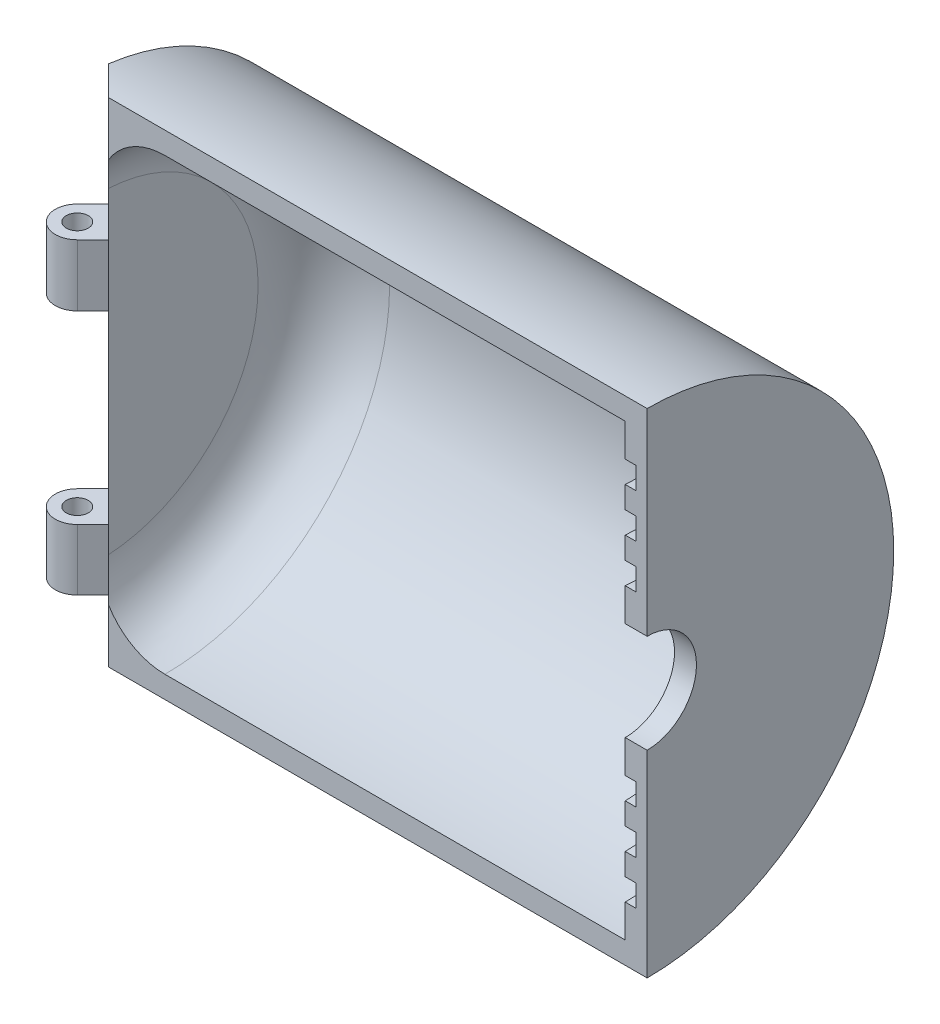
from build123d import *
from build123d.topology import SkipClean

# Parameters (mm, degrees)
BOSS_EXTRUDE1_DEPTH = 1
CUT_EXTRUDE1_DEPTH  = 0.5
BOSS_EXTRUDE2_START = -25
BOSS_EXTRUDE2_DEPTH = 25
BOSS_EXTRUDE3_START = 1
BOSS_EXTRUDE3_DEPTH = 1
SKETCH7_R           = 0.5
BOSS_EXTRUDE4_DEPTH = 22.5
SKETCH10_R          = 0.5
CUT_EXTRUDE4_DEPTH  = 40.5
SKETCH8_W           = 10.868003522
SKETCH8_H           = 5.625
CUT_EXTRUDE2_DEPTH  = 22.5
LPATTERN1_COUNT     = 2
LPATTERN1_PITCH     = 11.25
CUT_EXTRUDE3_START  = -40.5
SKETCH9_R           = 20.473718745
SKETCH9_R_2         = 11.25
CUT_EXTRUDE3_DEPTH  = 40.5
SKETCH11_W          = 6.72531589
SKETCH11_H          = 3.584111804
SKETCH11_W_2        = 7.229090256
SKETCH11_H_2        = 3.619498095
CUT_EXTRUDE5_DEPTH  = 40.5
FILLET1_R           = 3


with BuildPart() as part:
    # Sketch1 → Boss-Extrude1 (new body)
    with BuildSketch(Plane(origin=(0, 0, 0), x_dir=(0, 0, -1), z_dir=(1, 0, 0))):
        with BuildLine():
            Line((0, -2.25), (0, -10.25))
            ThreePointArc((0, -10.25), (10.25, 0), (0, 10.25))
            Line((0, 10.25), (0, 2.25))
            ThreePointArc((0, 2.25), (1.590990258, 1.590990258), (2.25, 0))
            ThreePointArc((2.25, 0), (1.590990258, -1.590990258), (0, -2.25))
        make_face()
    extrude(amount=BOSS_EXTRUDE1_DEPTH)

    # Sketch2 → Cut-Extrude1 (cut)
    with BuildSketch(Plane.ZY):
        with BuildLine():
            ThreePointArc((0, 3.75), (2.651650429, 2.651650429), (3.75, 0))
            ThreePointArc((3.75, 0), (2.651650429, -2.651650429), (0, -3.75))
            Line((0, -3.75), (0, -4.75))
            ThreePointArc((0, -4.75), (3.358757211, -3.358757211), (4.75, 0))
            ThreePointArc((4.75, 0), (3.358757211, 3.358757211), (0, 4.75))
            Line((0, 4.75), (0, 3.75))
        make_face()
        with BuildLine():
            ThreePointArc((0, -3.75), (-3.75, 0), (0, 3.75))
            Line((0, 3.75), (0, 4.75))
            ThreePointArc((0, 4.75), (-4.75, 0), (0, -4.75))
            Line((0, -4.75), (0, -3.75))
        make_face()
        with BuildLine():
            Line((0, 6.75), (0, 5.75))
            ThreePointArc((0, 5.75), (4.065863992, 4.065863992), (5.75, 0))
            ThreePointArc((5.75, 0), (4.065863992, -4.065863992), (0, -5.75))
            Line((0, -5.75), (0, -6.75))
            ThreePointArc((0, -6.75), (4.772970773, -4.772970773), (6.75, 0))
            ThreePointArc((6.75, 0), (4.772970773, 4.772970773), (0, 6.75))
        make_face()
        with BuildLine():
            ThreePointArc((0, -5.75), (-5.75, 0), (0, 5.75))
            Line((0, 5.75), (0, 6.75))
            ThreePointArc((0, 6.75), (-6.75, 0), (0, -6.75))
            Line((0, -6.75), (0, -5.75))
        make_face()
        with BuildLine():
            Line((0, 8.75), (0, 7.75))
            ThreePointArc((0, 7.75), (5.480077554, 5.480077554), (7.75, 0))
            ThreePointArc((7.75, 0), (5.480077554, -5.480077554), (0, -7.75))
            Line((0, -7.75), (0, -8.75))
            ThreePointArc((0, -8.75), (6.187184335, -6.187184335), (8.75, 0))
            ThreePointArc((8.75, 0), (6.187184335, 6.187184335), (0, 8.75))
        make_face()
        with BuildLine():
            ThreePointArc((0, -7.75), (-7.75, 0), (0, 7.75))
            Line((0, 7.75), (0, 8.75))
            ThreePointArc((0, 8.75), (-8.75, 0), (0, -8.75))
            Line((0, -8.75), (0, -7.75))
        make_face()
    extrude(amount=-CUT_EXTRUDE1_DEPTH, mode=Mode.SUBTRACT)

    # Sketch3 → Boss-Extrude2 (add)
    with BuildSketch(Plane(origin=(1, 0, 0), x_dir=(0, 0, -1), z_dir=(1, 0, 0)).offset(BOSS_EXTRUDE2_START)):
        with BuildLine():
            Line((0, -10.25), (0, -11.25))
            ThreePointArc((0, -11.25), (11.25, 0), (0, 11.25))
            Line((0, 11.25), (0, 10.25))
            ThreePointArc((0, 10.25), (10.25, 0), (0, -10.25))
        make_face()
    extrude(amount=BOSS_EXTRUDE2_DEPTH)

    # Sketch6 → Boss-Extrude3 (add)
    with BuildSketch(Plane.ZY.offset(24).offset(BOSS_EXTRUDE3_START)):
        with BuildLine():
            Line((0, 11.25), (0, -11.25))
            ThreePointArc((0, -11.25), (-11.25, 0), (0, 11.25))
        make_face()
    extrude(amount=-BOSS_EXTRUDE3_DEPTH)

    # Sketch7 → Boss-Extrude4 (add)
    with SkipClean():  # the faces are left unmerged after this step: merging them gives an invalid solid
        with BuildSketch(Plane(origin=(0, 11.25, 0), x_dir=(1, 0, 0), z_dir=(0, 1, 0))):
            with BuildLine():
                Line((-23.585786438, 0), (-25, 1.414213562))
                Line((-25, 1.414213562), (-25.707106781, 0.707106781))
                ThreePointArc((-25.707106781, 0.707106781), (-25.707106781, -0.707106781), (-24.292893219, -0.707106781))
                Line((-24.292893219, -0.707106781), (-23.585786438, 0))
            make_face()
            with Locations(Location((-25, 0, 0), (0, 0, 270))):
                Circle(SKETCH7_R, mode=Mode.SUBTRACT)
        extrude(amount=-BOSS_EXTRUDE4_DEPTH)

    # Sketch10 → Cut-Extrude4 (cut)
    with BuildSketch(Plane(origin=(0, 11.25, 0), x_dir=(1, 0, 0), z_dir=(0, 1, 0))):
        with Locations(Location((-25, 0, 0), (0, 0, 270))):
            Circle(SKETCH10_R)
    extrude(amount=-CUT_EXTRUDE4_DEPTH, mode=Mode.SUBTRACT)

    # Sketch8 → Cut-Extrude2 (cut)
    with BuildSketch(Plane(origin=(-11.792893219, 0, -11.792893219), x_dir=(0.7071067811865439, 0, -0.7071067811865511), z_dir=(0.7071067811865511, 0, 0.7071067811865439))):
        with Locations((-22.111671291, 8.4375)):
            Rectangle(SKETCH8_W, SKETCH8_H)
    cut_extrude2 = extrude(amount=-CUT_EXTRUDE2_DEPTH, mode=Mode.SUBTRACT)

    # LPattern1: Cut-Extrude2 ×2
    with Locations(*[(0, -i * LPATTERN1_PITCH, 0) for i in range(1, LPATTERN1_COUNT)]):
        add(cut_extrude2, mode=Mode.SUBTRACT)

    # Sketch9 → Cut-Extrude3 (cut)
    with BuildSketch(Plane(origin=(1, 0, 0), x_dir=(0, 0, -1), z_dir=(1, 0, 0)).offset(CUT_EXTRUDE3_START)):
        Circle(SKETCH9_R)
        Circle(SKETCH9_R_2, mode=Mode.SUBTRACT)
    extrude(amount=CUT_EXTRUDE3_DEPTH, mode=Mode.SUBTRACT)

    # Sketch11 → Cut-Extrude5 (cut)
    with BuildSketch(Plane(origin=(-11.792893219, 0, -11.792893219), x_dir=(0.7071067811865434, 0, -0.7071067811865517), z_dir=(0.7071067811865517, 0, 0.7071067811865434))):
        with Locations((-20.040327475, 1.020444098)):
            Rectangle(SKETCH11_W, SKETCH11_H)
        with Locations((-20.292214658, -10.224678683)):
            Rectangle(SKETCH11_W_2, SKETCH11_H_2)
    extrude(amount=-CUT_EXTRUDE5_DEPTH, mode=Mode.SUBTRACT)

    # Fillet1
    # the kernel refuses this fillet: 3 mm, written as the material it adds along each edge
    with BuildSketch(Plane(origin=(-24, 0, 0), x_dir=(0, 0.7697147606602491, 0.6383879598032339), z_dir=(0, -0.6383879598032339, 0.7697147606602491))) as fillet1_piece_1_section:
        with BuildLine():
            CenterArc((10.25 - FILLET1_R, -FILLET1_R), FILLET1_R, 0, 90)
            Line((10.25 - FILLET1_R, 0), (10.25, 0))
            Line((10.25, 0), (10.25, -FILLET1_R))
        make_face()
    fillet1_piece_1 = revolve(axis=Axis((-24, 0, 0), (-1, 0, 0)), revolution_arc=259.343436967, mode=Mode.PRIVATE)
    fillet1_piece_1 = split(fillet1_piece_1, bisect_by=Plane(origin=(-23.150246859, 0, 0), z_dir=(0, 0, -1)), keep=Keep.TOP, mode=Mode.PRIVATE)
    fillet1_piece_1 = split(fillet1_piece_1, bisect_by=Plane(origin=(-28.068140078, 0, -4.482353641), z_dir=(0.7071067811865434, 0, -0.7071067811865517)), keep=Keep.TOP, mode=Mode.PRIVATE)
    add(fillet1_piece_1)


solid = part.part
